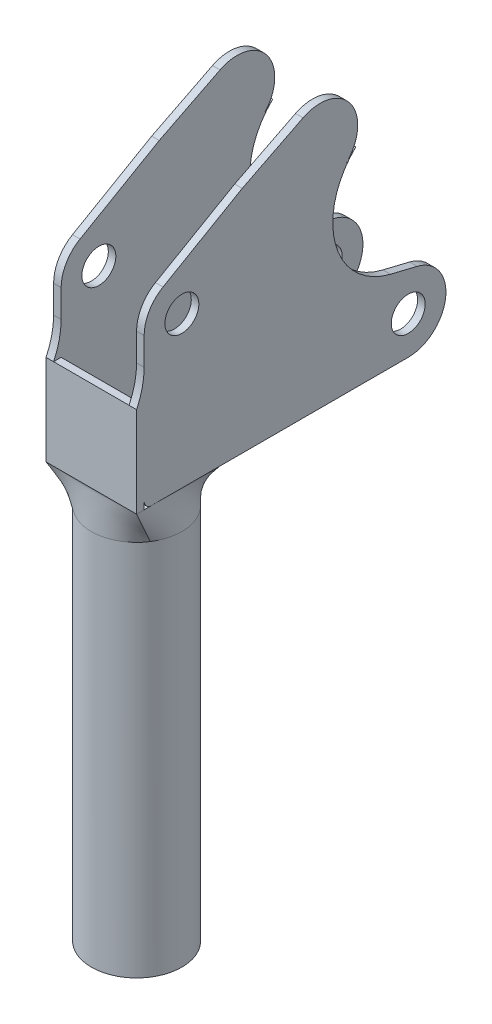
from build123d import *

# Parameters (mm, degrees)
SKETCH1_R            = 2.25
BOSS_EXTRUDE1_DEPTH  = 1
SKETCH2_R            = 3
BOSS_EXTRUDE2_DEPTH  = 10
SKETCH3_R            = 3.5
BOSS_EXTRUDE3_DEPTH  = 1.5
FILLET1_R            = 0.5
FILLET2_R            = 0.5
SKETCH4_W            = 12
SKETCH4_H            = 12
BOSS_EXTRUDE4_DEPTH  = 1
FILLET1_OF_MIRROR1_R = 0.5
FILLET2_OF_MIRROR1_R = 0.5
BOSS_EXTRUDE5_DEPTH  = 50
FILLET3_R            = 10
SKETCH8_R            = 8.284786219
CUT_EXTRUDE1_DEPTH   = 15
SKETCH9_R            = 7.33981862
CUT_EXTRUDE2_DEPTH   = 15


with BuildPart() as part:
    # Sketch1 → Boss-Extrude1 (new body)
    with BuildSketch(Plane(origin=(0, 0, 0), x_dir=(0, 0, -1), z_dir=(1, 0, 0))):
        with BuildLine():
            Line((-5, 15), (-5, -4))
            ThreePointArc((-5, -4), (-4.707106781, -4.707106781), (-4, -5))
            Line((-4, -5), (30, -5))
            ThreePointArc((30, -5), (34.964599416, -0.593929828), (31.179449472, 4.858898944))
            Line((31.179449472, 4.858898944), (27.641101056, 5.717797887))
            ThreePointArc((27.641101056, 5.717797887), (20.35004458, 12.812932929), (23.046734983, 22.622535708))
            Line((23.046734983, 22.622535708), (21.789863611, 21.406530033))
            ThreePointArc((21.789863611, 21.406530033), (22.387551219, 27.898260788), (16.058927441, 29.462971544))
            Line((16.058927441, 29.462971544), (8, 25.392304845))
            Line((8, 25.392304845), (-2.5, 19.330127019))
            ThreePointArc((-2.5, 19.330127019), (-4.330127019, 17.5), (-5, 15))
        make_face()
        with Locations((0, 15)):
            Circle(SKETCH1_R, mode=Mode.SUBTRACT)
        with Locations((30, 0)):
            Circle(SKETCH1_R, mode=Mode.SUBTRACT)
    boss_extrude1 = extrude(amount=BOSS_EXTRUDE1_DEPTH)

    # Sketch2 → Boss-Extrude2 (add)
    with BuildSketch(Plane(origin=(1, 0, 0), x_dir=(0, 0, -1), z_dir=(1, 0, 0))):
        with Locations((18.313231103, 25)):
            Circle(SKETCH2_R)
    boss_extrude2 = extrude(amount=BOSS_EXTRUDE2_DEPTH)

    # Sketch3 → Boss-Extrude3 (add)
    with BuildSketch(Plane(origin=(11, 0, 0), x_dir=(0, 0, -1), z_dir=(1, 0, 0))):
        with Locations((18.313231103, 25)):
            Circle(SKETCH3_R)
    boss_extrude3 = extrude(amount=-BOSS_EXTRUDE3_DEPTH)

    # Fillet1
    fillet1_edges = [part.edges().sort_by_distance(p)[0] for p in [
        (1, 25, -15.313231103),
        (9.5, 25, -14.813231103),
        (11, 25, -14.813231103),
    ]]
    fillet(fillet1_edges, radius=FILLET1_R - 0.0001)  # a hair under: the kernel refuses the full size

    # Fillet2
    fillet2_edges = [part.edges().sort_by_distance(p)[0] for p in [
        (9.5, 25, -15.313231103),
    ]]
    fillet(fillet2_edges, radius=FILLET2_R)

    # Sketch4 → Boss-Extrude4 (add)
    with BuildSketch(Plane.XY.offset(5)):
        with Locations((-5, 1)):
            Rectangle(SKETCH4_W, SKETCH4_H)
    extrude(amount=BOSS_EXTRUDE4_DEPTH)

    # Mirror1: Boss-Extrude1, Boss-Extrude2, Boss-Extrude3 across plane
    add(boss_extrude1.mirror(Plane(origin=(-5, 0, 0), x_dir=(0, 0, 1), z_dir=(1, 0, 0))))
    add(boss_extrude2.mirror(Plane(origin=(-5, 0, 0), x_dir=(0, 0, 1), z_dir=(1, 0, 0))))
    add(boss_extrude3.mirror(Plane(origin=(-5, 0, 0), x_dir=(0, 0, 1), z_dir=(1, 0, 0))))

    # Fillet1 of Mirror1
    fillet1_of_mirror1_edges = [part.edges().sort_by_distance(p)[0] for p in [
        (-11, 25, -15.313231103),
        (-19.5, 25, -14.813231103),
        (-21, 25, -14.813231103),
    ]]
    fillet(fillet1_of_mirror1_edges, radius=FILLET1_OF_MIRROR1_R - 0.0001)  # a hair under: the kernel refuses the full size

    # Fillet2 of Mirror1
    fillet2_of_mirror1_edges = [part.edges().sort_by_distance(p)[0] for p in [
        (-19.5, 25, -15.313231103),
    ]]
    fillet(fillet2_of_mirror1_edges, radius=FILLET2_OF_MIRROR1_R)

    # Loft1: read off the stored shape, not the designer's step
    # Loft1: loft between two sections, ruled curve by curve
    loft1_from = [
        Edge.make_bspline([(-10, -5, -5), (-10, -5, -4.583333333), (-10, -5, -4.166666667), (-10, -5, -3.333333333), (-10, -5, -2.916666667), (-10, -5, -2.291666667), (-10, -5, -2.083333333), (-10, -5, -1.666666667), (-10, -5, -1.458333333), (-10, -5, -1.041666667), (-10, -5, -0.833333333), (-10, -5, -0.416666667), (-10, -5, -0.208333333), (-10, -5, 0.208333333), (-10, -5, 0.416666667), (-10, -5, 0.833333333), (-10, -5, 1.041666667), (-10, -5, 1.458333333), (-10, -5, 1.666666667), (-10, -5, 2.083333333), (-10, -5, 2.291666667), (-10, -5, 2.916666667), (-10, -5, 3.333333333), (-10, -5, 4.166666667), (-10, -5, 4.583333333), (-10, -5, 5)], [0, 0, 0, 0, 0.125, 0.125, 0.25, 0.25, 0.3125, 0.3125, 0.375, 0.375, 0.4375, 0.4375, 0.5, 0.5, 0.5625, 0.5625, 0.625, 0.625, 0.6875, 0.6875, 0.75, 0.75, 0.875, 0.875, 1, 1, 1, 1], 3),
        Edge.make_bspline([(-10, -5, 5), (-9.583333333, -5, 5), (-9.166666667, -5, 5), (-8.333333333, -5, 5), (-7.916666667, -5, 5), (-7.291666667, -5, 5), (-7.083333333, -5, 5), (-6.666666667, -5, 5), (-6.458333333, -5, 5), (-6.041666667, -5, 5), (-5.833333333, -5, 5), (-5.416666667, -5, 5), (-5.208333333, -5, 5), (-4.791666667, -5, 5), (-4.583333333, -5, 5), (-4.166666667, -5, 5), (-3.958333333, -5, 5), (-3.541666667, -5, 5), (-3.333333333, -5, 5), (-2.916666667, -5, 5), (-2.708333333, -5, 5), (-2.083333333, -5, 5), (-1.666666667, -5, 5), (-0.833333333, -5, 5), (-0.416666667, -5, 5), (0, -5, 5)], [0, 0, 0, 0, 0.125, 0.125, 0.25, 0.25, 0.3125, 0.3125, 0.375, 0.375, 0.4375, 0.4375, 0.5, 0.5, 0.5625, 0.5625, 0.625, 0.625, 0.6875, 0.6875, 0.75, 0.75, 0.875, 0.875, 1, 1, 1, 1], 3),
        Edge.make_bspline([(-11, -5, -5), (-10.833333333, -5, -5), (-10.666666667, -5, -5), (-10.333333333, -5, -5), (-10.166666667, -5, -5), (-10, -5, -5)], [0, 0, 0, 0, 0.5, 0.5, 1, 1, 1, 1], 3),
        Edge.make_bspline([(0, -5, 5), (0, -5, 3.333333333), (0, -5, 1.666666667), (0, -5, -1.666666667), (0, -5, -3.333333333), (0, -5, -5)], [0, 0, 0, 0, 0.5, 0.5, 1, 1, 1, 1], 3),
        Edge.make_bspline([(0, -5, -5), (0.166666667, -5, -5), (0.333333333, -5, -5), (0.666666667, -5, -5), (0.833333333, -5, -5), (1, -5, -5)], [0, 0, 0, 0, 0.5, 0.5, 1, 1, 1, 1], 3),
        Edge.make_bspline([(1, -5, -5), (1, -5, -4.541666667), (1, -5, -4.083333333), (1, -5, -3.166666667), (1, -5, -2.708333333), (1, -5, -1.791666667), (1, -5, -1.333333333), (1, -5, -0.416666667), (1, -5, 0.041666667), (1, -5, 0.958333333), (1, -5, 1.416666667), (1, -5, 2.333333333), (1, -5, 2.791666667), (1, -5, 3.708333333), (1, -5, 4.166666667), (1, -5, 5.083333333), (1, -5, 5.541666667), (1, -5, 6)], [0, 0, 0, 0, 0.125, 0.125, 0.25, 0.25, 0.375, 0.375, 0.5, 0.5, 0.625, 0.625, 0.75, 0.75, 0.875, 0.875, 1, 1, 1, 1], 3),
        Edge.make_bspline([(1, -5, 6), (0.5, -5, 6), (0, -5, 6), (-1, -5, 6), (-1.5, -5, 6), (-2.5, -5, 6), (-3, -5, 6), (-4, -5, 6), (-4.5, -5, 6), (-5.5, -5, 6), (-6, -5, 6), (-7, -5, 6), (-7.5, -5, 6), (-8.5, -5, 6), (-9, -5, 6), (-10, -5, 6), (-10.5, -5, 6), (-11, -5, 6)], [0, 0, 0, 0, 0.125, 0.125, 0.25, 0.25, 0.375, 0.375, 0.5, 0.5, 0.625, 0.625, 0.75, 0.75, 0.875, 0.875, 1, 1, 1, 1], 3),
        Edge.make_bspline([(-11, -5, 6), (-11, -5, 5.541666667), (-11, -5, 5.083333333), (-11, -5, 4.166666667), (-11, -5, 3.708333333), (-11, -5, 2.791666667), (-11, -5, 2.333333333), (-11, -5, 1.416666667), (-11, -5, 0.958333333), (-11, -5, 0.041666667), (-11, -5, -0.416666667), (-11, -5, -1.333333333), (-11, -5, -1.791666667), (-11, -5, -2.708333333), (-11, -5, -3.166666667), (-11, -5, -4.083333333), (-11, -5, -4.541666667), (-11, -5, -5)], [0, 0, 0, 0, 0.125, 0.125, 0.25, 0.25, 0.375, 0.375, 0.5, 0.5, 0.625, 0.625, 0.75, 0.75, 0.875, 0.875, 1, 1, 1, 1], 3),
    ]
    loft1_to = [
        Edge.make_bspline([(-6.491374966, -10, -4.77239989), (-6.884523079, -10, -4.649541105), (-7.306405333, -10, -4.465018398), (-8.153984507, -10, -3.912579276), (-8.579853175, -10, -3.542579514), (-9.13555864, -10, -2.826386266), (-9.306401184, -10, -2.561259986), (-9.601142837, -10, -1.983589792), (-9.724904097, -10, -1.6710271), (-9.908481295, -10, -1.011860503), (-9.968151405, -10, -0.665329215), (-10.012336326, -10, 0.040937796), (-9.996767222, -10, 0.400514491), (-9.888777725, -10, 1.108127646), (-9.796385387, -10, 1.455980277), (-9.543549977, -10, 2.116918741), (-9.383234434, -10, 2.429877815), (-9.011400762, -10, 3.004282647), (-8.800043483, -10, 3.265702589), (-8.346413903, -10, 3.729163159), (-8.104267576, -10, 3.931262826), (-7.360235299, -10, 4.449101898), (-6.843390506, -10, 4.675233288), (-5.86961438, -10, 4.949713698), (-5.411897706, -10, 5), (-5, -10, 5)], [0, 0, 0, 0, 0.125, 0.125, 0.25, 0.25, 0.3125, 0.3125, 0.375, 0.375, 0.4375, 0.4375, 0.5, 0.5, 0.5625, 0.5625, 0.625, 0.625, 0.6875, 0.6875, 0.75, 0.75, 0.875, 0.875, 1, 1, 1, 1], 3),
        Edge.make_bspline([(-5, -10, 5), (-4.588102294, -10, 5), (-4.13038562, -10, 4.949713698), (-3.156609494, -10, 4.675233288), (-2.639764701, -10, 4.449101898), (-1.895732424, -10, 3.931262826), (-1.653586097, -10, 3.729163159), (-1.199956517, -10, 3.265702589), (-0.988599238, -10, 3.004282647), (-0.616765566, -10, 2.429877815), (-0.456450023, -10, 2.116918741), (-0.203614613, -10, 1.455980277), (-0.111222275, -10, 1.108127646), (-0.003232778, -10, 0.400514491), (0.012336326, -10, 0.040937796), (-0.031848595, -10, -0.665329215), (-0.091518705, -10, -1.011860503), (-0.275095903, -10, -1.6710271), (-0.398857163, -10, -1.983589792), (-0.693598816, -10, -2.561259986), (-0.86444136, -10, -2.826386266), (-1.420146825, -10, -3.542579514), (-1.846015493, -10, -3.912579276), (-2.693594667, -10, -4.465018398), (-3.115476921, -10, -4.649541105), (-3.508625034, -10, -4.77239989)], [0, 0, 0, 0, 0.125, 0.125, 0.25, 0.25, 0.3125, 0.3125, 0.375, 0.375, 0.4375, 0.4375, 0.5, 0.5, 0.5625, 0.5625, 0.625, 0.625, 0.6875, 0.6875, 0.75, 0.75, 0.875, 0.875, 1, 1, 1, 1], 3),
        Edge.make_bspline([(-6.789649959, -10, -5.726879868), (-6.73993746, -10, -5.567799872), (-6.690224961, -10, -5.408719876), (-6.590799963, -10, -5.090559883), (-6.541087465, -10, -4.931479887), (-6.491374966, -10, -4.77239989)], [0, 0, 0, 0, 0.5, 0.5, 1, 1, 1, 1], 3),
        Edge.make_bspline([(-3.508625034, -10, -4.77239989), (-3.463431854, -10, -4.917018069), (-3.418238673, -10, -5.061636247), (-3.327852311, -10, -5.350872604), (-3.28265913, -10, -5.495490783), (-3.23746595, -10, -5.640108961)], [0, 0, 0, 0, 0.5, 0.5, 1, 1, 1, 1], 3),
        Edge.make_bspline([(-3.23746595, -10, -5.640108961), (-3.232946632, -10, -5.654570779), (-3.228427313, -10, -5.669032597), (-3.219388677, -10, -5.697956233), (-3.214869359, -10, -5.71241805), (-3.210350041, -10, -5.726879868)], [0, 0, 0, 0, 0.5, 0.5, 1, 1, 1, 1], 3),
        Edge.make_bspline([(-3.210350041, -10, -5.726879868), (-2.831118631, -10, -5.608370053), (-2.444582437, -10, -5.445988039), (-1.68630321, -10, -5.020792589), (-1.314753176, -10, -4.757739856), (-0.6243761, -10, -4.131712499), (-0.305916835, -10, -3.768655763), (0.240427003, -10, -2.962280853), (0.467933473, -10, -2.519164633), (0.80657041, -10, -1.590039936), (0.917547461, -10, -1.104452382), (1.018204484, -10, -0.135638547), (1.008043933, -10, 0.34718985), (0.882399891, -10, 1.27063142), (0.767250763, -10, 1.711070799), (0.460401457, -10, 2.524472335), (0.269002994, -10, 2.897493483), (0.054966106, -10, 3.232231066)], [0, 0, 0, 0, 0.125, 0.125, 0.25, 0.25, 0.375, 0.375, 0.5, 0.5, 0.625, 0.625, 0.75, 0.75, 0.875, 0.875, 1, 1, 1, 1], 3),
        Edge.make_bspline([(0.054966106, -10, 3.232231066), (-0.171961928, -10, 3.587129432), (-0.449964287, -10, 3.939123113), (-1.116581513, -10, 4.597670796), (-1.505515592, -10, 4.903878589), (-2.382177474, -10, 5.42277159), (-2.869914306, -10, 5.634856039), (-3.90530121, -10, 5.923723677), (-4.452465382, -10, 6), (-5.547534618, -10, 6), (-6.09469879, -10, 5.923723677), (-7.130085694, -10, 5.634856039), (-7.617822526, -10, 5.42277159), (-8.494484408, -10, 4.903878589), (-8.883418487, -10, 4.597670796), (-9.550035713, -10, 3.939123113), (-9.828038072, -10, 3.587129432), (-10.054966106, -10, 3.232231066)], [0, 0, 0, 0, 0.125, 0.125, 0.25, 0.25, 0.375, 0.375, 0.5, 0.5, 0.625, 0.625, 0.75, 0.75, 0.875, 0.875, 1, 1, 1, 1], 3),
        Edge.make_bspline([(-10.054966106, -10, 3.232231066), (-10.269002994, -10, 2.897493483), (-10.460401457, -10, 2.524472335), (-10.767250763, -10, 1.711070799), (-10.882399891, -10, 1.27063142), (-11.008043933, -10, 0.34718985), (-11.018204484, -10, -0.135638547), (-10.917547461, -10, -1.104452382), (-10.80657041, -10, -1.590039936), (-10.467933473, -10, -2.519164633), (-10.240427003, -10, -2.962280853), (-9.694083165, -10, -3.768655763), (-9.3756239, -10, -4.131712499), (-8.685246824, -10, -4.757739856), (-8.31369679, -10, -5.020792589), (-7.555417563, -10, -5.445988039), (-7.168881369, -10, -5.608370053), (-6.789649959, -10, -5.726879868)], [0, 0, 0, 0, 0.125, 0.125, 0.25, 0.25, 0.375, 0.375, 0.5, 0.5, 0.625, 0.625, 0.75, 0.75, 0.875, 0.875, 1, 1, 1, 1], 3),
    ]
    loft1 = Solid(Shell([*[Face.make_surface_from_curves(loft1_from[k], loft1_to[k]) for k in range(8)], Face(Wire(loft1_from)), Face(Wire(loft1_to))]))
    add(loft1)

    # Sketch7<3> → Boss-Extrude5 (add)
    with BuildSketch(Plane(origin=(0, -10, 0), x_dir=(-1, 0, 0), z_dir=(0, -1, 0))):
        with BuildLine():
            Line((3.508625034, 4.77239989), (3.210350041, 5.726879868))
            ThreePointArc((3.210350041, 5.726879868), (5, -6), (6.789649959, 5.726879868))
            Line((6.789649959, 5.726879868), (6.491374966, 4.77239989))
            ThreePointArc((6.491374966, 4.77239989), (5, -5), (3.508625034, 4.77239989))
        make_face()
    extrude(amount=BOSS_EXTRUDE5_DEPTH)

    # Fillet3
    # the kernel refuses this fillet: 10 mm, written as the material it adds along each edge
    with BuildSketch(Plane(origin=(0.897247359, 7, 5), x_dir=(0, 0, 1), z_dir=(-1, 0, 0))) as fillet3_piece_1_section:
        with BuildLine():
            CenterArc((10, 4.358898944), FILLET3_R, 180, 25.841932763)
            Line((0, 4.358898944), (0, 0))
            Line((0, 0), (1, 0))
        make_face()
    fillet3_piece_1 = extrude(amount=22.794494718, mode=Mode.PRIVATE)
    fillet3_piece_1 = split(fillet3_piece_1, bisect_by=Plane(origin=(0, 7, 5), z_dir=(1, 0, 0)), keep=Keep.TOP, mode=Mode.PRIVATE)
    add(fillet3_piece_1)
    with BuildSketch(Plane(origin=(-10, 7, 5), x_dir=(0, 0, 1), z_dir=(-1, 0, 0)), Plane(origin=(1, 7, 5), x_dir=(0, 0, 1), z_dir=(-1, 0, 0))) as fillet3_piece_2:
        with BuildLine():
            CenterArc((10, 4.358898944), FILLET3_R, 180, 25.841932763)
            Line((0, 4.358898944), (0, 0))
            Line((0, 0), (1, 0))
        make_face()
    extrude(amount=1)
    with BuildSketch(Plane(origin=(11.897247359, 7, 5), x_dir=(0, 0, 1), z_dir=(-1, 0, 0))) as fillet3_piece_3_section:
        with BuildLine():
            CenterArc((10, 4.358898944), FILLET3_R, 180, 25.841932763)
            Line((0, 4.358898944), (0, 0))
            Line((0, 0), (1, 0))
        make_face()
    fillet3_piece_3 = extrude(amount=22.794494718, mode=Mode.PRIVATE)
    fillet3_piece_3 = split(fillet3_piece_3, bisect_by=Plane(origin=(-10, 7, 5), z_dir=(-1, 0, 0)), keep=Keep.TOP, mode=Mode.PRIVATE)
    add(fillet3_piece_3)

    # Sketch8 → Cut-Extrude1 (cut)
    with BuildSketch(Plane(origin=(1, 0, 0), x_dir=(0, 0, -1), z_dir=(1, 0, 0))):
        with Locations((18.313231103, 25)):
            Circle(SKETCH8_R)
    extrude(amount=CUT_EXTRUDE1_DEPTH, mode=Mode.SUBTRACT)

    # Sketch9 → Cut-Extrude2 (cut)
    with BuildSketch(Plane.ZY.offset(11)):
        with Locations((-18.313231103, 25)):
            Circle(SKETCH9_R)
    extrude(amount=CUT_EXTRUDE2_DEPTH, mode=Mode.SUBTRACT)


solid = part.part
